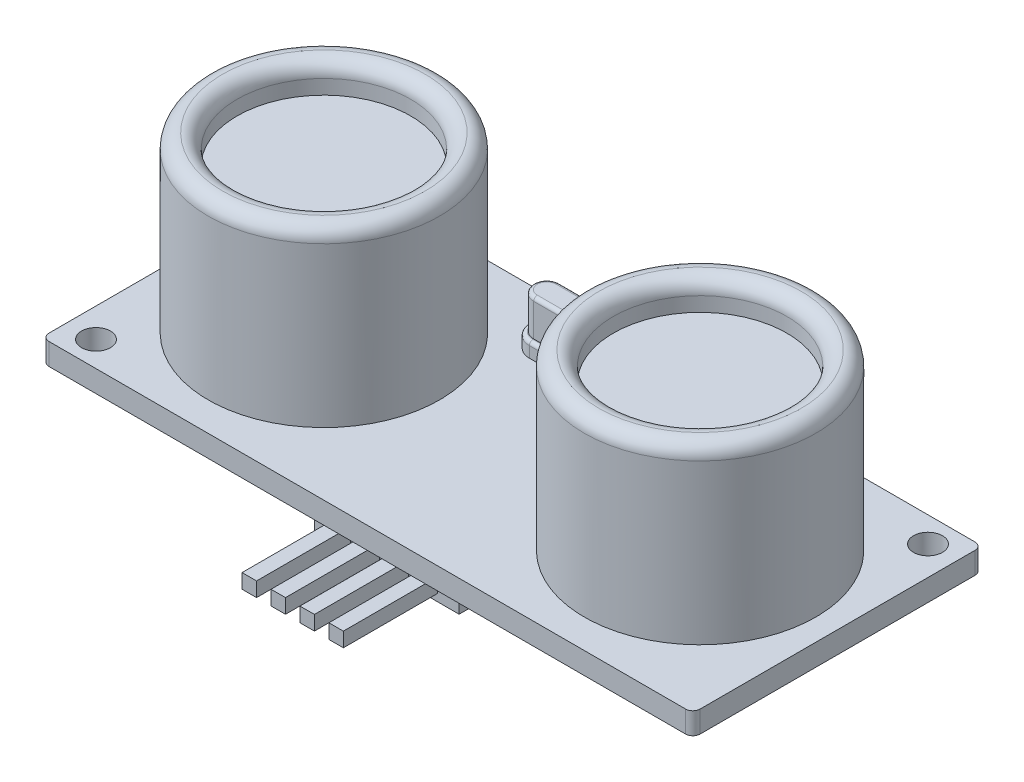
from build123d import *

# Parameters (mm, degrees)
SKETCH1_W           = 45
SKETCH1_H           = 20
BOSS_EXTRUDE1_DEPTH = 1.5
SKETCH2_R           = 8
BOSS_EXTRUDE3_DEPTH = 12
SKETCH3_R           = 1
CUT_EXTRUDE1_DEPTH  = 3
SKETCH4_R           = 6
CUT_EXTRUDE2_DEPTH  = 2
SKETCH5_R           = 6
CUT_EXTRUDE3_DEPTH  = 2
FILLET1_R           = 1
FILLET2_R           = 0.5
BOSS_EXTRUDE5_DEPTH = 1
BOSS_EXTRUDE6_DEPTH = 2.5
FILLET3_R           = 0.25
SKETCH8_W           = 10
SKETCH8_H           = 2
BOSS_EXTRUDE7_DEPTH = 2
SKETCH9_W           = 1
SKETCH9_H           = 1
BOSS_EXTRUDE9_DEPTH = 6.5


with BuildPart() as part:
    # Sketch1 → Boss-Extrude1 (new body)
    with BuildSketch(Plane(origin=(0, 0, 0), x_dir=(1, 0, 0), z_dir=(0, 1, 0))):
        Rectangle(SKETCH1_W, SKETCH1_H)
    extrude(amount=BOSS_EXTRUDE1_DEPTH)

    # Sketch2 → Boss-Extrude3 (add)
    with BuildSketch(Plane(origin=(0, 1.5, 0), x_dir=(1, 0, 0), z_dir=(0, 1, 0))):
        with Locations(Location((-13, 0, 0), (0, 0, 90))):
            Circle(SKETCH2_R)
        with Locations(Location((13, 0, 0), (0, 0, 90))):
            Circle(SKETCH2_R)
    extrude(amount=BOSS_EXTRUDE3_DEPTH)

    # Sketch3 → Cut-Extrude1 (cut)
    with BuildSketch(Plane(origin=(0, 1.5, 0), x_dir=(1, 0, 0), z_dir=(0, 1, 0))):
        with Locations(Location((-20.5, -8.25, 0), (0, 0, 270))):
            Circle(SKETCH3_R)
        with Locations(Location((20.5, 8.25, 0), (0, 0, 270))):
            Circle(SKETCH3_R)
    extrude(amount=-CUT_EXTRUDE1_DEPTH, mode=Mode.SUBTRACT)

    # Sketch4 → Cut-Extrude2 (cut)
    with BuildSketch(Plane(origin=(0, 13.5, 0), x_dir=(1, 0, 0), z_dir=(0, 1, 0))):
        with Locations(Location((-13, 0, 0), (0, 0, 270))):
            Circle(SKETCH4_R)
    extrude(amount=-CUT_EXTRUDE2_DEPTH, mode=Mode.SUBTRACT)

    # Sketch5 → Cut-Extrude3 (cut)
    with BuildSketch(Plane(origin=(0, 13.5, 0), x_dir=(1, 0, 0), z_dir=(0, 1, 0))):
        with Locations(Location((13, 0, 0), (0, 0, 270))):
            Circle(SKETCH5_R)
    extrude(amount=-CUT_EXTRUDE3_DEPTH, mode=Mode.SUBTRACT)

    # Fillet1
    fillet1_edges = [part.edges().sort_by_distance(p)[0] for p in [
        (-13, 13.5, 8),
        (13, 13.5, 8),
        (-13, 13.5, -6),
        (13, 13.5, -6),
    ]]
    fillet(fillet1_edges, radius=FILLET1_R - 0.0001)  # a hair under: the kernel refuses the full size

    # Fillet2
    fillet2_edges = [part.edges().sort_by_distance(p)[0] for p in [
        (22.5, 0.75, 10),
        (-22.5, 0.75, 10),
        (-22.5, 0.75, -10),
        (22.5, 0.75, -10),
    ]]
    fillet(fillet2_edges, radius=FILLET2_R)

    # Sketch6 → Boss-Extrude5 (add)
    with BuildSketch(Plane(origin=(0, 1.5, 0), x_dir=(1, 0, 0), z_dir=(0, 1, 0))):
        with BuildLine():
            Line((-4.401032614, 8), (4.398967386, 8))
            ThreePointArc((4.398967386, 8), (5.598967386, 6.8), (4.398967386, 5.6))
            Line((4.398967386, 5.6), (-4.401032614, 5.6))
            ThreePointArc((-4.401032614, 5.6), (-5.601032614, 6.8), (-4.401032614, 8))
        make_face()
    extrude(amount=BOSS_EXTRUDE5_DEPTH)

    # Sketch7 → Boss-Extrude6 (add)
    with BuildSketch(Plane(origin=(0, 2.5, 0), x_dir=(1, 0, 0), z_dir=(0, 1, 0))):
        with BuildLine():
            Line((-4.401032614, 7.7), (4.398967386, 7.7))
            ThreePointArc((4.398967386, 7.7), (5.298967386, 6.8), (4.398967386, 5.9))
            Line((4.398967386, 5.9), (-4.401032614, 5.9))
            ThreePointArc((-4.401032614, 5.9), (-5.301032614, 6.8), (-4.401032614, 7.7))
        make_face()
    extrude(amount=BOSS_EXTRUDE6_DEPTH)

    # Fillet3
    fillet3_edges = [part.edges().sort_by_distance(p)[0] for p in [
        (-5.601032614, 2.5, -6.8),
        (-0.001032614, 2.5, -5.6),
        (5.598967386, 2.5, -6.8),
        (-0.001032614, 2.5, -8),
        (-5.301032614, 5, -6.8),
        (-0.001032614, 5, -5.9),
        (5.298967386, 5, -6.8),
        (-0.001032614, 5, -7.7),
    ]]
    fillet(fillet3_edges, radius=FILLET3_R)

    # Sketch8 → Boss-Extrude7 (add)
    with BuildSketch(Plane.XZ):
        with Locations((0, 7.654908977)):
            Rectangle(SKETCH8_W, SKETCH8_H)
    extrude(amount=BOSS_EXTRUDE7_DEPTH)

    # Sketch9 → Boss-Extrude9 (add)
    with BuildSketch(Plane.XY.offset(8.654908977)):
        with Locations((-3, -1.004826008)):
            Rectangle(SKETCH9_W, SKETCH9_H)
        with Locations((-1, -1.003766726)):
            Rectangle(SKETCH9_W, SKETCH9_H)
        with Locations((1, -1.009532884)):
            Rectangle(SKETCH9_W, SKETCH9_H)
        with Locations((3, -1.009532884)):
            Rectangle(SKETCH9_W, SKETCH9_H)
    extrude(amount=BOSS_EXTRUDE9_DEPTH)


solid = part.part
